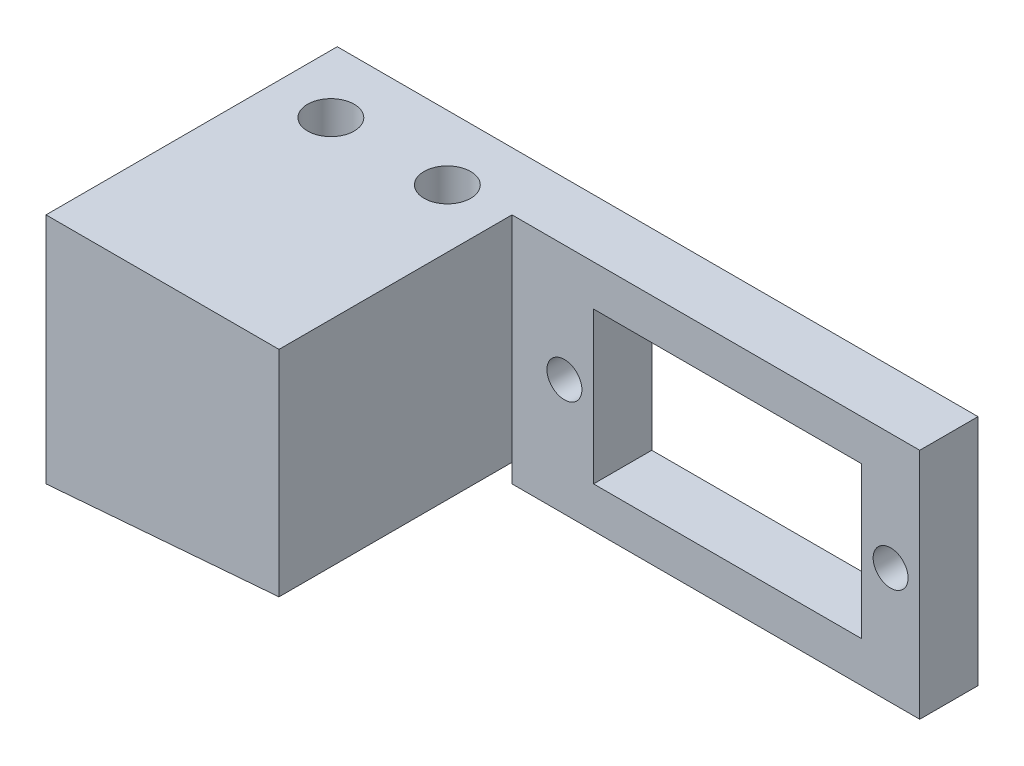
from build123d import *

# Parameters (mm, degrees)
ESQUISSE1_W             = 55
ESQUISSE1_H             = 20
BOSS_EXTRU_1_DEPTH      = 5
ESQUISSE3_R             = 1.5
ESQUISSE3_W             = 23
ESQUISSE3_H             = 13
ENL_V_MAT_EXTRU_2_DEPTH = 20
BOSS_EXTRU_2_DEPTH      = 25
ESQUISSE2_R             = 2
ENL_V_MAT_EXTRU_1_DEPTH = 20
ENL_V_MAT_EXTRU_4_DEPTH = 15


with BuildPart() as part:
    # Esquisse1 → Boss.-Extru.1 (new body)
    with BuildSketch(Plane.XY):
        with Locations((-0.833333333, -1.666666667)):
            Rectangle(ESQUISSE1_W, ESQUISSE1_H)
    extrude(amount=BOSS_EXTRU_1_DEPTH)

    # Esquisse3 → Enlèv. mat.-Extru.2 (cut)
    with BuildSketch(Plane.XY.offset(5)):
        with Locations((24.166666667, -1.666666667)):
            Circle(ESQUISSE3_R)
        with Locations((-3.833333333, -1.666666667)):
            Circle(ESQUISSE3_R)
        with Locations((10.166666667, -1.666666667)):
            Rectangle(ESQUISSE3_W, ESQUISSE3_H)
    extrude(amount=-ENL_V_MAT_EXTRU_2_DEPTH, mode=Mode.SUBTRACT)

    # Esquisse5 → Boss.-Extru.2 (add)
    with BuildSketch(Plane(origin=(0, 0, 0), x_dir=(-1, 0, 0), z_dir=(0, 0, -1))):
        Polygon((28.333333333, -11.666666667), (28.333333333, 8.333333333), (8.333333333, 8.333333333), (8.333333333, -10.066666667), align=None)
    extrude(amount=-BOSS_EXTRU_2_DEPTH)

    # Esquisse2 → Enlèv. mat.-Extru.1 (cut)
    with BuildSketch(Plane(origin=(0, 8.333333333, 0), x_dir=(1, 0, 0), z_dir=(0, 1, 0))):
        with Locations((-23.333333333, -5.548124667)):
            Circle(ESQUISSE2_R)
        with Locations((-13.333333333, -5.548124667)):
            Circle(ESQUISSE2_R)
    extrude(amount=-ENL_V_MAT_EXTRU_1_DEPTH, mode=Mode.SUBTRACT)

    # Esquisse7 → Enlèv. mat.-Extru.4 (cut)
    with BuildSketch(Plane.XY.offset(5)):
        Polygon((-8.333333333, -10.066666667), (-8.333333333, -11.666666667), (-28.333333333, -11.666666667), align=None)
    extrude(amount=-ENL_V_MAT_EXTRU_4_DEPTH, mode=Mode.SUBTRACT)


solid = part.part
